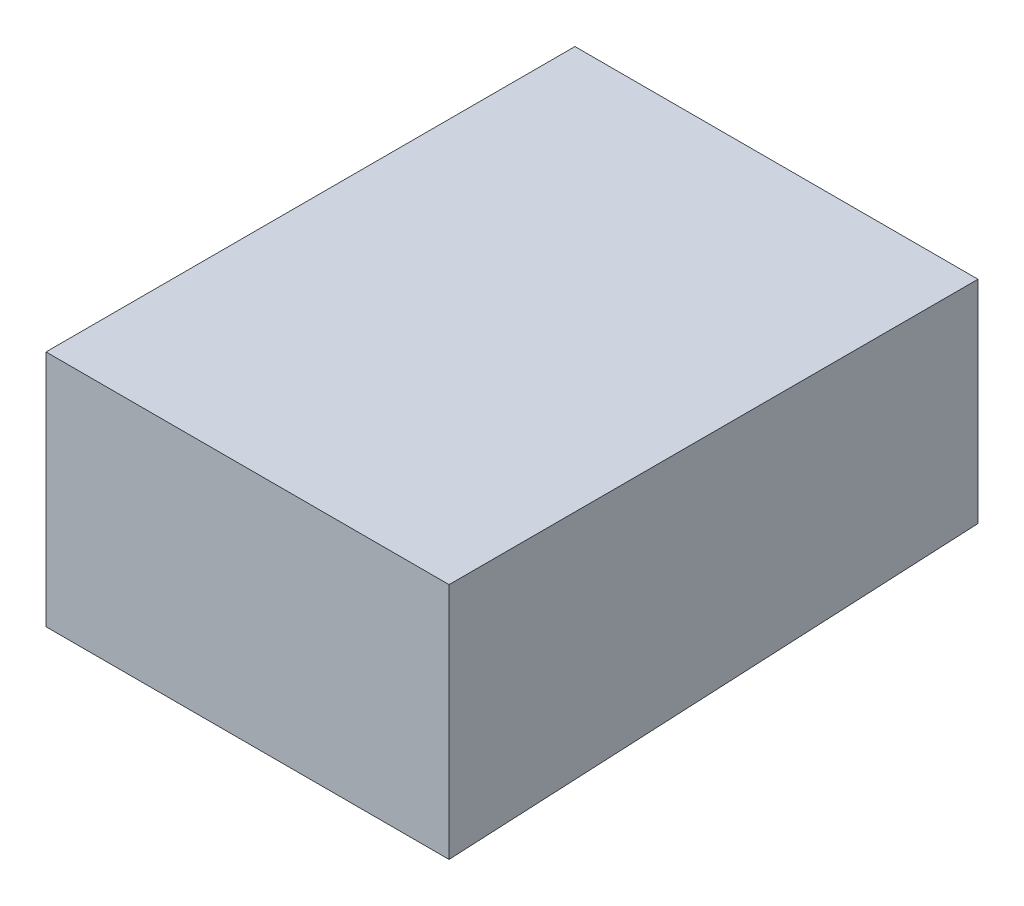
from build123d import *

# Parameters (mm, degrees)
SKETCH17_W              = 152.4
SKETCH17_H              = 95
BOSS_EXTRUDE1_DEPTH     = 200
CUT_EXTRUDE1_DEPTH      = 241.637569802
CUT_EXTRUDE1_DEPTH_BACK = 241.637569802


with BuildPart() as part:
    # Sketch17 → Boss-Extrude1 (new body)
    with BuildSketch(Plane.XY):
        with Locations((0, -62.5)):
            Rectangle(SKETCH17_W, SKETCH17_H)
    extrude(amount=-BOSS_EXTRUDE1_DEPTH)

    # Sketch15 → Cut-Extrude1 (cut, two sides: drawn at the far end of the back side and taken through both)
    with BuildSketch(Plane(origin=(0, 0, 0), x_dir=(0, 0, -1), z_dir=(1, 0, 0)).offset(-CUT_EXTRUDE1_DEPTH_BACK)):
        Polygon((0, -110), (200, -110), (200, -95), (0, -105), align=None)
    extrude(amount=CUT_EXTRUDE1_DEPTH + CUT_EXTRUDE1_DEPTH_BACK, mode=Mode.SUBTRACT)


solid = part.part
